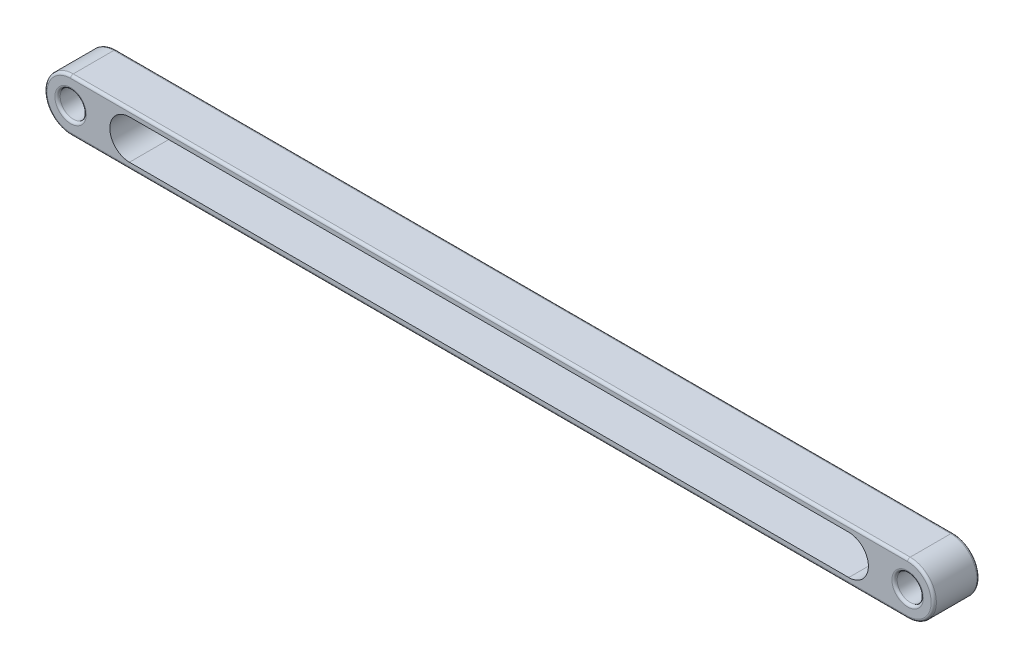
from build123d import *

# Parameters (mm, degrees)
BOSS_EXTRUDE2_DEPTH = 17.5
SKETCH5_R           = 10
CUT_EXTRUDE1_DEPTH  = 343.381366315
CUT_EXTRUDE2_DEPTH  = 40
FILLET1_R           = 2


with BuildPart() as part:
    # Sketch4 → Boss-Extrude2 (new, symmetric)
    with BuildSketch(Plane.XY):
        with BuildLine():
            Line((-320, 20), (320, 20))
            ThreePointArc((320, 20), (340, 0), (320, -20))
            Line((320, -20), (-320, -20))
            ThreePointArc((-320, -20), (-340, 0), (-320, 20))
        make_face()
    extrude(amount=BOSS_EXTRUDE2_DEPTH, both=True)

    # Sketch5 → Cut-Extrude1 (cut, through all)
    with BuildSketch(Plane.XY.offset(17.5)):
        with Locations((320, 0)):
            Circle(SKETCH5_R)
        with Locations((-320, 0)):
            Circle(SKETCH5_R)
    extrude(amount=-CUT_EXTRUDE1_DEPTH, mode=Mode.SUBTRACT)

    # Sketch6 → Cut-Extrude2 (cut)
    with BuildSketch(Plane(origin=(0, 0, -17.5), x_dir=(-1, 0, 0), z_dir=(0, 0, -1))):
        with BuildLine():
            Line((-275, 15), (275, 15))
            ThreePointArc((275, 15), (290, 0), (275, -15))
            Line((275, -15), (-275, -15))
            ThreePointArc((-275, -15), (-290, 0), (-275, 15))
        make_face()
    extrude(amount=-CUT_EXTRUDE2_DEPTH, mode=Mode.SUBTRACT)

    # Fillet1
    fillet1_edges = [part.edges().sort_by_distance(p)[0] for p in [
        (340, 0, 17.5),
        (0, -20, 17.5),
        (-340, 0, 17.5),
        (340, 0, -17.5),
        (0, -20, -17.5),
        (-340, 0, -17.5),
        (0, 20, 17.5),
        (0, 20, -17.5),
        (310, 0, 17.5),
        (310, 0, -17.5),
        (-330, 0, 17.5),
        (-330, 0, -17.5),
    ]]
    fillet(fillet1_edges, radius=FILLET1_R)


solid = part.part
